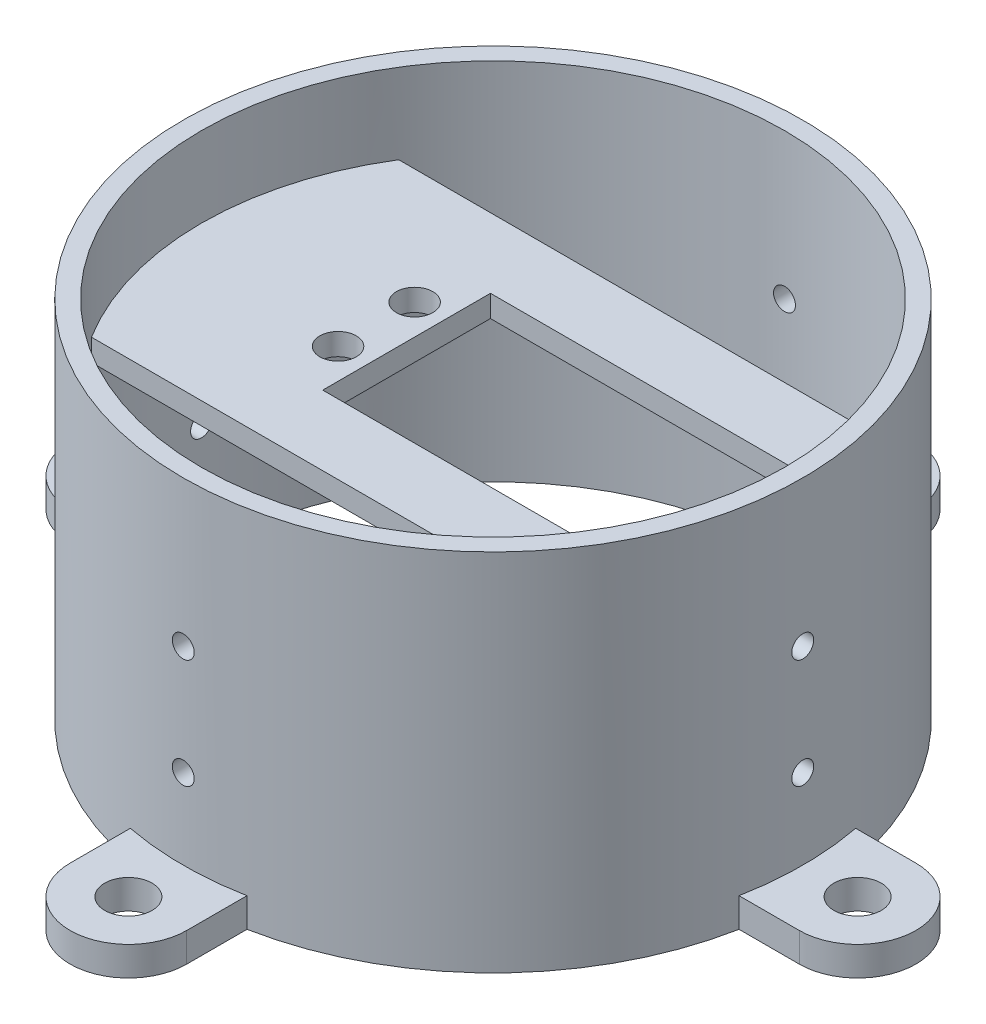
from build123d import *

# Parameters (mm, degrees)
SKETCH1_R                      = 42.5
SKETCH1_R_2                    = 40
BOSS_EXTRUDE1_DEPTH            = 50
SKETCH2_R                      = 3.25
BOSS_EXTRUDE2_DEPTH            = 4
CIRPATTERN1_COUNT              = 4
BOSS_EXTRUDE3_DEPTH            = 3
CUT_EXTRUDE1_REACH             = 92.824
SKETCH3_R                      = 2.5
SKETCH3_W                      = 42
SKETCH3_H                      = 23
CUT_EXTRUDE2_REACH             = 98.063
SKETCH6_R                      = 1.5
CUT_EXTRUDE2_DIRECTION_2_REACH = 98.063
CIRPATTERN2_COUNT              = 2
CIRPATTERN2_ANGLE              = 90


with BuildPart() as part:
    # Sketch1 → Boss-Extrude1 (new body)
    with BuildSketch(Plane(origin=(0, 0, 0), x_dir=(1, 0, 0), z_dir=(0, 1, 0))):
        Circle(SKETCH1_R)
        Circle(SKETCH1_R_2, mode=Mode.SUBTRACT)
    extrude(amount=BOSS_EXTRUDE1_DEPTH)

    # Sketch2 → Boss-Extrude2 (add)
    with BuildSketch(Plane.XZ):
        with BuildLine():
            Line((50.000268327, 8), (41.740268327, 8))
            ThreePointArc((41.740268327, 8), (42.309640768, 4.017996771), (42.5, 0))
            ThreePointArc((42.5, 0), (42.309640768, -4.017996771), (41.740268327, -8))
            Line((41.740268327, -8), (50.000268327, -8))
            ThreePointArc((50.000268327, -8), (58.000268327, 0), (50.000268327, 8))
        make_face()
        with Locations((50.000268327, 0)):
            Circle(SKETCH2_R, mode=Mode.SUBTRACT)
    boss_extrude2 = extrude(amount=-BOSS_EXTRUDE2_DEPTH)

    # CirPattern1: Boss-Extrude2 ×4 about axis
    cirpattern1_axis = Axis((0, 0, 0), (0, 1, 0))
    for i in range(1, CIRPATTERN1_COUNT):
        add(boss_extrude2.rotate(cirpattern1_axis, i * 360 / CIRPATTERN1_COUNT))

    # Sketch4 → Boss-Extrude3 (add)
    with BuildSketch(Plane(origin=(0, 36, 0), x_dir=(1, 0, 0), z_dir=(0, 1, 0))):
        with BuildLine():
            Line((34, -21.071307506), (-34, -21.071307506))
            ThreePointArc((-34, -21.071307506), (-40, 0), (-34, 21.071307506))
            Line((-34, 21.071307506), (34, 21.071307506))
            ThreePointArc((34, 21.071307506), (40, 0), (34, -21.071307506))
        make_face()
    extrude(amount=BOSS_EXTRUDE3_DEPTH)

    # Sketch3 → Cut-Extrude1 (cut, up to next)
    with BuildSketch(Plane(origin=(0, 39, 0), x_dir=(1, 0, 0), z_dir=(0, 1, 0)), mode=Mode.PRIVATE) as cut_extrude1_sk1:
        with Locations((34.300268327, 5.25)):
            Circle(SKETCH3_R)
    cut_extrude1_tool1 = extrude(cut_extrude1_sk1.sketch, amount=-CUT_EXTRUDE1_REACH, mode=Mode.PRIVATE) & part.part
    # Sketch3 → Cut-Extrude1 (cut, up to next)
    with BuildSketch(Plane(origin=(0, 39, 0), x_dir=(1, 0, 0), z_dir=(0, 1, 0)), mode=Mode.PRIVATE) as cut_extrude1_sk2:
        with Locations((34.300268327, -5.25)):
            Circle(SKETCH3_R)
    cut_extrude1_tool2 = extrude(cut_extrude1_sk2.sketch, amount=-CUT_EXTRUDE1_REACH, mode=Mode.PRIVATE) & part.part
    # Sketch3 → Cut-Extrude1 (cut, up to next)
    with BuildSketch(Plane(origin=(0, 39, 0), x_dir=(1, 0, 0), z_dir=(0, 1, 0)), mode=Mode.PRIVATE) as cut_extrude1_sk3:
        with Locations((-15.999731673, -5.25)):
            Circle(SKETCH3_R)
    cut_extrude1_tool3 = extrude(cut_extrude1_sk3.sketch, amount=-CUT_EXTRUDE1_REACH, mode=Mode.PRIVATE) & part.part
    # Sketch3 → Cut-Extrude1 (cut, up to next)
    with BuildSketch(Plane(origin=(0, 39, 0), x_dir=(1, 0, 0), z_dir=(0, 1, 0)), mode=Mode.PRIVATE) as cut_extrude1_sk4:
        with Locations((-15.999731673, 5.25)):
            Circle(SKETCH3_R)
    cut_extrude1_tool4 = extrude(cut_extrude1_sk4.sketch, amount=-CUT_EXTRUDE1_REACH, mode=Mode.PRIVATE) & part.part
    # Sketch3 → Cut-Extrude1 (cut, up to next)
    with BuildSketch(Plane(origin=(0, 39, 0), x_dir=(1, 0, 0), z_dir=(0, 1, 0)), mode=Mode.PRIVATE) as cut_extrude1_sk5:
        with Locations((9.150268327, 0)):
            Rectangle(SKETCH3_W, SKETCH3_H)
    cut_extrude1_tool5 = extrude(cut_extrude1_sk5.sketch, amount=-CUT_EXTRUDE1_REACH, mode=Mode.PRIVATE) & part.part
    add(cut_extrude1_tool1.solids().sort_by_distance((34.300268, 39, -5.25))[0], mode=Mode.SUBTRACT)
    add(cut_extrude1_tool2.solids().sort_by_distance((34.300268, 39, 5.25))[0], mode=Mode.SUBTRACT)
    add(cut_extrude1_tool3.solids().sort_by_distance((-15.999732, 39, 5.25))[0], mode=Mode.SUBTRACT)
    add(cut_extrude1_tool4.solids().sort_by_distance((-15.999732, 39, -5.25))[0], mode=Mode.SUBTRACT)
    add(cut_extrude1_tool5.solids().sort_by_distance((9.150268, 39, 0))[0], mode=Mode.SUBTRACT)

    # Sketch6 → Cut-Extrude2 (cut, up to next)
    with BuildSketch(Plane.XY, mode=Mode.PRIVATE) as cut_extrude2_sk1:
        with Locations((0, 15)):
            Circle(SKETCH6_R)
    cut_extrude2_tool1 = extrude(cut_extrude2_sk1.sketch, amount=-CUT_EXTRUDE2_REACH, mode=Mode.PRIVATE) & part.part
    # Sketch6 → Cut-Extrude2 (cut, up to next)
    with BuildSketch(Plane.XY, mode=Mode.PRIVATE) as cut_extrude2_sk2:
        with Locations((0, 30)):
            Circle(SKETCH6_R)
    cut_extrude2_tool2 = extrude(cut_extrude2_sk2.sketch, amount=-CUT_EXTRUDE2_REACH, mode=Mode.PRIVATE) & part.part
    cut_extrude2_1 = cut_extrude2_tool1.solids().sort_by_distance((0, 15, 0))[0]
    add(cut_extrude2_1, mode=Mode.SUBTRACT)
    cut_extrude2_2 = cut_extrude2_tool2.solids().sort_by_distance((0, 30, 0))[0]
    add(cut_extrude2_2, mode=Mode.SUBTRACT)
    cut_extrude2 = cut_extrude2_1 + cut_extrude2_2  # Cut-Extrude2 as one shape, for the pattern or mirror that repeats it

    # Sketch6 → Cut-Extrude2 direction 2 (cut, up to next)
    with BuildSketch(Plane.XY, mode=Mode.PRIVATE) as cut_extrude2_direction_2_sk1:
        with Locations((0, 15)):
            Circle(SKETCH6_R)
    cut_extrude2_direction_2_tool1 = extrude(cut_extrude2_direction_2_sk1.sketch, amount=CUT_EXTRUDE2_DIRECTION_2_REACH, mode=Mode.PRIVATE) & part.part
    # Sketch6 → Cut-Extrude2 direction 2 (cut, up to next)
    with BuildSketch(Plane.XY, mode=Mode.PRIVATE) as cut_extrude2_direction_2_sk2:
        with Locations((0, 30)):
            Circle(SKETCH6_R)
    cut_extrude2_direction_2_tool2 = extrude(cut_extrude2_direction_2_sk2.sketch, amount=CUT_EXTRUDE2_DIRECTION_2_REACH, mode=Mode.PRIVATE) & part.part
    cut_extrude2_direction_2_1 = cut_extrude2_direction_2_tool1.solids().sort_by_distance((0, 15, 0))[0]
    add(cut_extrude2_direction_2_1, mode=Mode.SUBTRACT)
    cut_extrude2_direction_2_2 = cut_extrude2_direction_2_tool2.solids().sort_by_distance((0, 30, 0))[0]
    add(cut_extrude2_direction_2_2, mode=Mode.SUBTRACT)
    cut_extrude2_direction_2 = cut_extrude2_direction_2_1 + cut_extrude2_direction_2_2  # Cut-Extrude2 direction 2 as one shape, for the pattern or mirror that repeats it

    # CirPattern2: Cut-Extrude2, Cut-Extrude2 direction 2 ×2 about axis
    cirpattern2_axis = Axis((0, 50, 0), (0, 1, 0))
    add([cut_extrude2.rotate(cirpattern2_axis, i * CIRPATTERN2_ANGLE / (CIRPATTERN2_COUNT - 1)) for i in range(1, CIRPATTERN2_COUNT)], mode=Mode.SUBTRACT)
    add([cut_extrude2_direction_2.rotate(cirpattern2_axis, i * CIRPATTERN2_ANGLE / (CIRPATTERN2_COUNT - 1)) for i in range(1, CIRPATTERN2_COUNT)], mode=Mode.SUBTRACT)


solid = part.part
